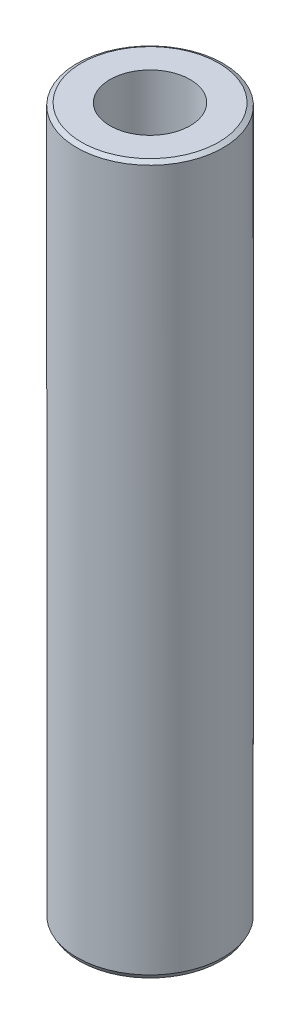
from build123d import *
from OCP.BRepFilletAPI import BRepFilletAPI_MakeChamfer

# Parameters (mm, degrees)
SKETCH1_R           = 60
BOSS_EXTRUDE1_DEPTH = 581.39934048
SKETCH2_R           = 32.91510204
CUT_EXTRUDE1_DEPTH  = 588.558672058
CHAMFER1_SIZE       = 2.127526155
CHAMFER1_SIZE2      = 3.684983394


with BuildPart() as part:
    # Sketch1 → Boss-Extrude1 (new body)
    with BuildSketch(Plane(origin=(0, 0, 0), x_dir=(1, 0, 0), z_dir=(0, 1, 0))):
        Circle(SKETCH1_R)
    extrude(amount=BOSS_EXTRUDE1_DEPTH)

    # Sketch2 → Cut-Extrude1 (cut, through all)
    with BuildSketch(Plane(origin=(0, 0, 0), x_dir=(1, 0, 0), z_dir=(0, 1, 0))):
        Circle(SKETCH2_R)
    extrude(amount=CUT_EXTRUDE1_DEPTH, mode=Mode.SUBTRACT)

    # Chamfer1: one chamfer whose edges measure the first distance from different faces: ONE call of the kernel's chamfer builder (chamfer() names one face for all edges)
    chamfer1_edges_1 = [part.edges().sort_by_distance(p)[0] for p in [
        (-60, 581.39934048, 0),
    ]]
    chamfer1_side_1 = [part.faces().sort_by_distance(p)[0] for p in [
        (-60, 290.69967024, 0),
    ]]
    chamfer1_edges_2 = [part.edges().sort_by_distance(p)[0] for p in [
        (-60, 0, 0),
    ]]
    chamfer1_side_2 = [part.faces().sort_by_distance(p)[0] for p in [
        (-58.302943725, 0, 0),
    ]]
    chamfer1 = BRepFilletAPI_MakeChamfer(part.part.solid().wrapped)
    for e in chamfer1_edges_1:
        chamfer1.Add(CHAMFER1_SIZE, CHAMFER1_SIZE2, e.wrapped, chamfer1_side_1[0].wrapped)  # the first distance lies on this face
    for e in chamfer1_edges_2:
        chamfer1.Add(CHAMFER1_SIZE, CHAMFER1_SIZE2, e.wrapped, chamfer1_side_2[0].wrapped)  # the first distance lies on this face
    add(Compound.cast(chamfer1.Shape()), mode=Mode.REPLACE)


solid = part.part
